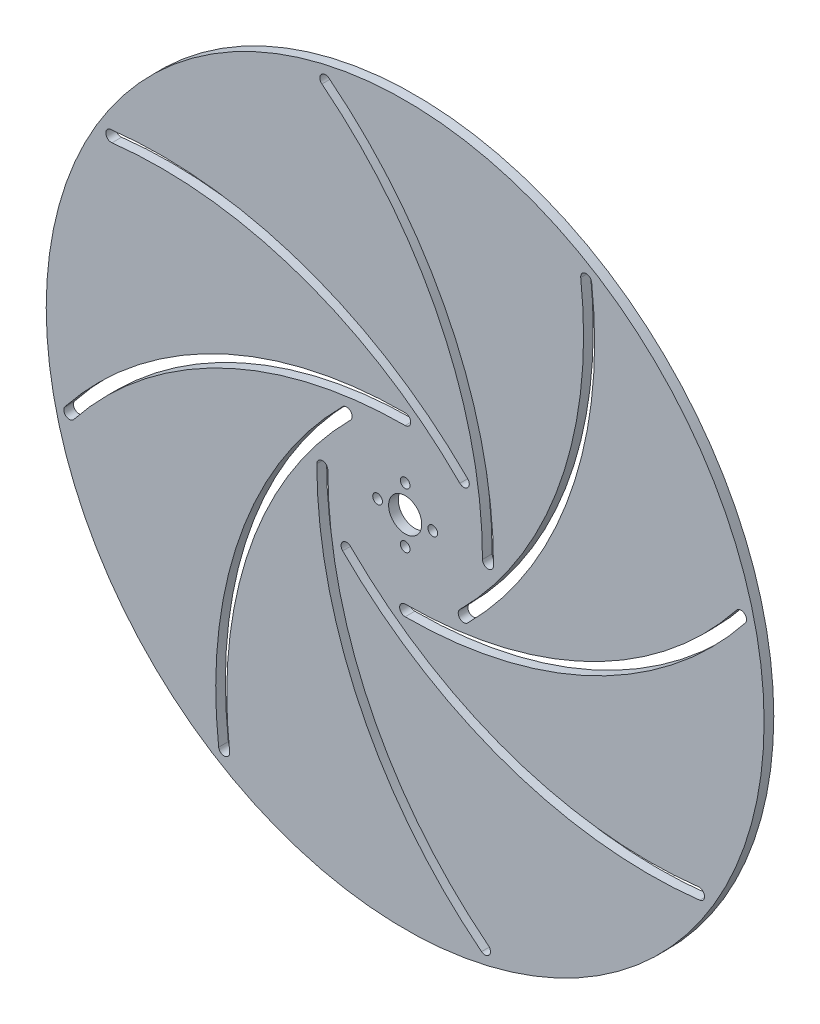
from build123d import *

# Parameters (mm, degrees)
BOSS_EXTRUDE1_DEPTH      = 1.75
BOSS_EXTRUDE1_DEPTH_BACK = 1.75
SKETCH1_R                = 130
SKETCH1_R_2              = 1.75


with BuildPart() as part:
    # Sketch1 → Boss-Extrude1 (new, two sides: drawn at the far end of the back side and taken through both)
    with BuildSketch(Plane.XY.offset(-BOSS_EXTRUDE1_DEPTH_BACK)):
        Circle(SKETCH1_R)
        with BuildLine():
            ThreePointArc((-67.544596294, -106.66174343), (-59.916490457, -36.86480939), (-22.627416998, 22.627416998))
            ThreePointArc((-22.627416998, 22.627416998), (-19.798989873, 22.627416998), (-19.798989873, 19.798989873))
            ThreePointArc((-19.798989873, 19.798989873), (-56.138023244, -38.177511002), (-63.571782436, -106.196179206))
            ThreePointArc((-63.571782436, -106.196179206), (-65.325407253, -108.415368247), (-67.544596294, -106.66174343))
        make_face(mode=Mode.SUBTRACT)
        with BuildLine():
            ThreePointArc((27.66, -123.182484144), (-16.3, -68.434713414), (-32, 0))
            ThreePointArc((-32, 0), (-30, 2), (-28, 0))
            ThreePointArc((-28, 0), (-12.7, -66.691153836), (30.14, -120.044076905))
            ThreePointArc((30.14, -120.044076905), (30.46920362, -122.853280525), (27.66, -123.182484144))
        make_face(mode=Mode.SUBTRACT)
        with BuildLine():
            ThreePointArc((106.66174343, -67.544596294), (36.86480939, -59.916490457), (-22.627416998, -22.627416998))
            ThreePointArc((-22.627416998, -22.627416998), (-22.627416998, -19.798989873), (-19.798989873, -19.798989873))
            ThreePointArc((-19.798989873, -19.798989873), (38.177511002, -56.138023244), (106.196179206, -63.571782436))
            ThreePointArc((106.196179206, -63.571782436), (108.415368247, -65.325407253), (106.66174343, -67.544596294))
        make_face(mode=Mode.SUBTRACT)
        with Locations((0, -10)):
            Circle(SKETCH1_R_2, mode=Mode.SUBTRACT)
        with Locations((10, 0)):
            Circle(SKETCH1_R_2, mode=Mode.SUBTRACT)
        with BuildLine():
            ThreePointArc((123.182484144, 27.66), (68.434713414, -16.3), (0, -32))
            ThreePointArc((0, -32), (-2, -30), (0, -28))
            ThreePointArc((0, -28), (66.691153836, -12.7), (120.044076905, 30.14))
            ThreePointArc((120.044076905, 30.14), (122.853280525, 30.46920362), (123.182484144, 27.66))
        make_face(mode=Mode.SUBTRACT)
        with BuildLine():
            ThreePointArc((-123.182484144, -27.66), (-68.434713414, 16.3), (0, 32))
            ThreePointArc((0, 32), (2, 30), (0, 28))
            ThreePointArc((0, 28), (-66.691153836, 12.7), (-120.044076905, -30.14))
            ThreePointArc((-120.044076905, -30.14), (-122.853280525, -30.46920362), (-123.182484144, -27.66))
        make_face(mode=Mode.SUBTRACT)
        with Locations((-10, 0)):
            Circle(SKETCH1_R_2, mode=Mode.SUBTRACT)
        with BuildLine():
            ThreePointArc((-106.66174343, 67.544596294), (-36.86480939, 59.916490457), (22.627416998, 22.627416998))
            ThreePointArc((22.627416998, 22.627416998), (22.627416998, 19.798989873), (19.798989873, 19.798989873))
            ThreePointArc((19.798989873, 19.798989873), (-38.177511002, 56.138023244), (-106.196179206, 63.571782436))
            ThreePointArc((-106.196179206, 63.571782436), (-108.415368247, 65.325407253), (-106.66174343, 67.544596294))
        make_face(mode=Mode.SUBTRACT)
        with BuildLine():
            ThreePointArc((0.666666667, 5.96284794), (4.472135955, 4), (6, 0))
            ThreePointArc((6, 0), (-4.062019202, -4.415880433), (-0.5, 5.979130372))
            ThreePointArc((-0.5, 5.979130372), (0.083730065, 5.999415745), (0.666666667, 5.96284794))
        make_face(mode=Mode.SUBTRACT)
        with Locations((0, 10)):
            Circle(SKETCH1_R_2, mode=Mode.SUBTRACT)
        with BuildLine():
            ThreePointArc((-27.66, 123.182484144), (16.3, 68.434713414), (32, 0))
            ThreePointArc((32, 0), (30, -2), (28, 0))
            ThreePointArc((28, 0), (12.7, 66.691153836), (-30.14, 120.044076905))
            ThreePointArc((-30.14, 120.044076905), (-30.46920362, 122.853280525), (-27.66, 123.182484144))
        make_face(mode=Mode.SUBTRACT)
        with BuildLine():
            ThreePointArc((67.544596294, 106.66174343), (59.916490457, 36.86480939), (22.627416998, -22.627416998))
            ThreePointArc((22.627416998, -22.627416998), (19.798989873, -22.627416998), (19.798989873, -19.798989873))
            ThreePointArc((19.798989873, -19.798989873), (56.138023244, 38.177511002), (63.571782436, 106.196179206))
            ThreePointArc((63.571782436, 106.196179206), (65.325407253, 108.415368247), (67.544596294, 106.66174343))
        make_face(mode=Mode.SUBTRACT)
    extrude(amount=BOSS_EXTRUDE1_DEPTH + BOSS_EXTRUDE1_DEPTH_BACK)


solid = part.part
